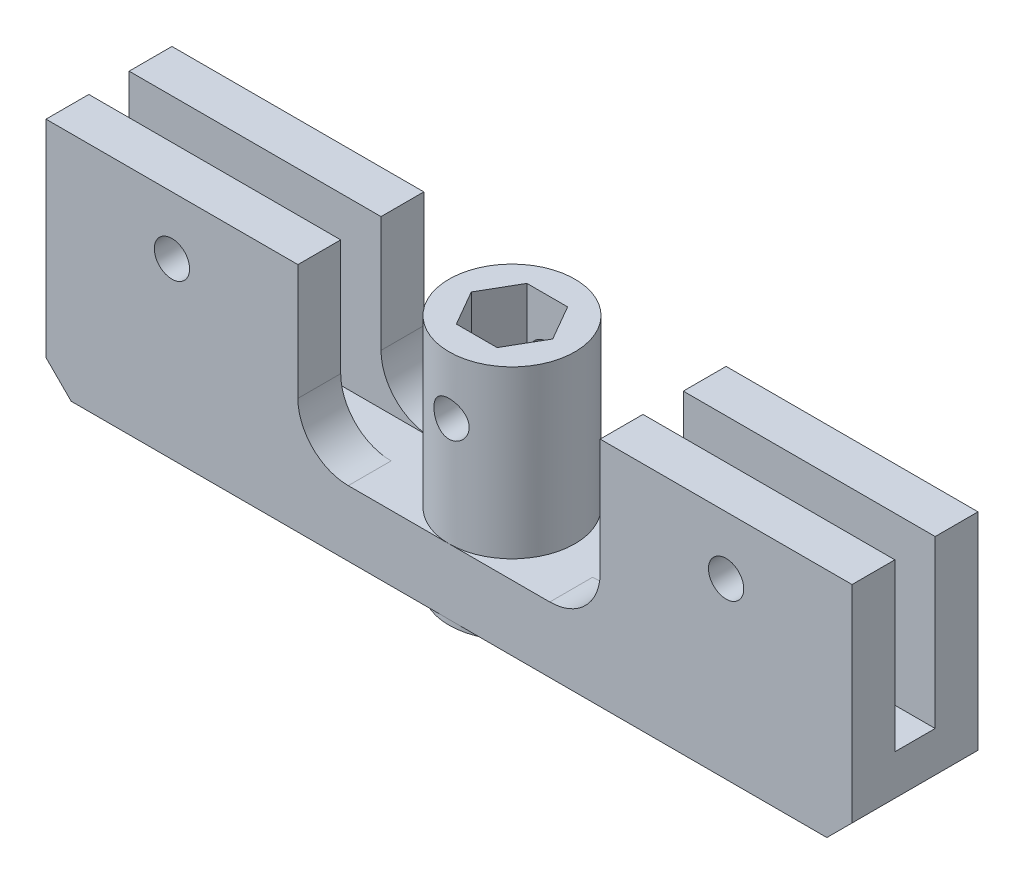
from build123d import *
from build123d.topology import SkipClean

# Parameters (mm, degrees)
SKETCH1_R           = 6.25
BOSS_EXTRUDE1_DEPTH = 24
SKETCH2_R           = 1.75
CUT_EXTRUDE2_DEPTH  = 7.5
SKETCH3_W           = 80
SKETCH3_H           = 12.5
BOSS_EXTRUDE2_DEPTH = 7.5
CUT_EXTRUDE3_DEPTH  = 44.718560184
SKETCH5_W           = 80
SKETCH5_H           = 12.5
CUT_EXTRUDE4_DEPTH  = 1
BOSS_EXTRUDE3_START = -23.5
SKETCH6_R           = 6.25
BOSS_EXTRUDE3_DEPTH = 23.5
SKETCH7_W           = 25
SKETCH7_H           = 4.25
BOSS_EXTRUDE4_DEPTH = 16.5
FILLET1_R           = 5
SKETCH8_R           = 1.75
CUT_EXTRUDE5_DEPTH  = 7.5
LPATTERN1_COUNT     = 2
LPATTERN1_PITCH     = 27.5
LPATTERN1_COL_COUNT = 2
LPATTERN1_COL_PITCH = 27.5
CHAMFER1_SIZE       = 2.5


with BuildPart() as part:
    # Sketch1 → Boss-Extrude1 (new body)
    with BuildSketch(Plane(origin=(0, 0, 0), x_dir=(1, 0, 0), z_dir=(0, 1, 0))):
        with Locations(Location((0, 0, 0), (0, 0, 270))):
            Circle(SKETCH1_R)
        Polygon((4.041451884, 0), (2.020725942, 3.5), (-2.020725942, 3.5), (-4.041451884, 0), (-2.020725942, -3.5), (2.020725942, -3.5), align=None, mode=Mode.SUBTRACT)
    extrude(amount=BOSS_EXTRUDE1_DEPTH)

    # Sketch2 → Cut-Extrude2 (cut, symmetric)
    with BuildSketch(Plane.XY):
        with Locations((0, 17.746)):
            Circle(SKETCH2_R)
    extrude(amount=CUT_EXTRUDE2_DEPTH, both=True, mode=Mode.SUBTRACT)

    # Sketch3 → Boss-Extrude2 (add)
    with BuildSketch(Plane.XZ):
        Rectangle(SKETCH3_W, SKETCH3_H)
    extrude(amount=-BOSS_EXTRUDE2_DEPTH)

    # Sketch4 → Cut-Extrude3 (cut, through all)
    with BuildSketch(Plane(origin=(0, 7.5, 0), x_dir=(1, 0, 0), z_dir=(0, 1, 0))):
        Polygon((-2.020725942, -3.5), (2.020725942, -3.5), (4.041451884, 0), (2.020725942, 3.5), (-2.020725942, 3.5), (-4.041451884, 0), align=None)
    extrude(amount=-CUT_EXTRUDE3_DEPTH, mode=Mode.SUBTRACT)

    # Sketch5 → Cut-Extrude4 (cut)
    with BuildSketch(Plane.XZ):
        Rectangle(SKETCH5_W, SKETCH5_H)
    extrude(amount=-CUT_EXTRUDE4_DEPTH, mode=Mode.SUBTRACT)

    # Sketch6 → Boss-Extrude3 (add)
    with SkipClean():  # the faces are left unmerged after this step: merging them gives an invalid solid
        with BuildSketch(Plane(origin=(0, 24, 0), x_dir=(1, 0, 0), z_dir=(0, 1, 0)).offset(BOSS_EXTRUDE3_START)):
            with Locations(Location((0, 0, 0), (0, 0, 270))):
                Circle(SKETCH6_R)
            Polygon((-2.020725942, 3.5), (-4.041451884, 0), (-2.020725942, -3.5), (2.020725942, -3.5), (4.041451884, 0), (2.020725942, 3.5), align=None, mode=Mode.SUBTRACT)
        extrude(amount=BOSS_EXTRUDE3_DEPTH)
    add(part.part.scale(1), mode=Mode.REPLACE)  # the faces are merged on a copy

    # Sketch7 → Boss-Extrude4 (add)
    with BuildSketch(Plane(origin=(0, 7.5, 0), x_dir=(1, 0, 0), z_dir=(0, 1, 0))):
        with Locations((-27.5, 4.125)):
            Rectangle(SKETCH7_W, SKETCH7_H)
        with Locations((-27.5, -4.125)):
            Rectangle(SKETCH7_W, SKETCH7_H)
    boss_extrude4 = extrude(amount=BOSS_EXTRUDE4_DEPTH)

    # Mirror1: Boss-Extrude4 across plane
    add(boss_extrude4.mirror(Plane(origin=(0, 0, 0), x_dir=(0, 0, 1), z_dir=(1, 0, 0))))

    # Fillet1
    fillet1_edges = [part.edges().sort_by_distance(p)[0] for p in [
        (-15, 7.5, -4.125),
        (-15, 7.5, 4.125),
        (15, 7.5, -4.125),
        (15, 7.5, 4.125),
    ]]
    fillet(fillet1_edges, radius=FILLET1_R)

    # Sketch8 → Cut-Extrude5 (cut, symmetric)
    with BuildSketch(Plane.XY):
        with Locations((0, 18.246)):
            Circle(SKETCH8_R)
    cut_extrude5 = extrude(amount=CUT_EXTRUDE5_DEPTH, both=True, mode=Mode.SUBTRACT)

    # LPattern1: Cut-Extrude5 ×2
    with Locations(*[(i * LPATTERN1_PITCH, 0, 0) for i in range(1, LPATTERN1_COUNT)]):
        add(cut_extrude5, mode=Mode.SUBTRACT)

    # LPattern1 col: Cut-Extrude5 ×2
    with Locations(*[(-i * LPATTERN1_COL_PITCH, 0, 0) for i in range(1, LPATTERN1_COL_COUNT)]):
        add(cut_extrude5, mode=Mode.SUBTRACT)

    # Chamfer1
    chamfer1_edges = [part.edges().sort_by_distance(p)[0] for p in [
        (40, 1, 0),
        (-40, 1, 0),
    ]]
    chamfer(chamfer1_edges, length=CHAMFER1_SIZE)


solid = part.part
